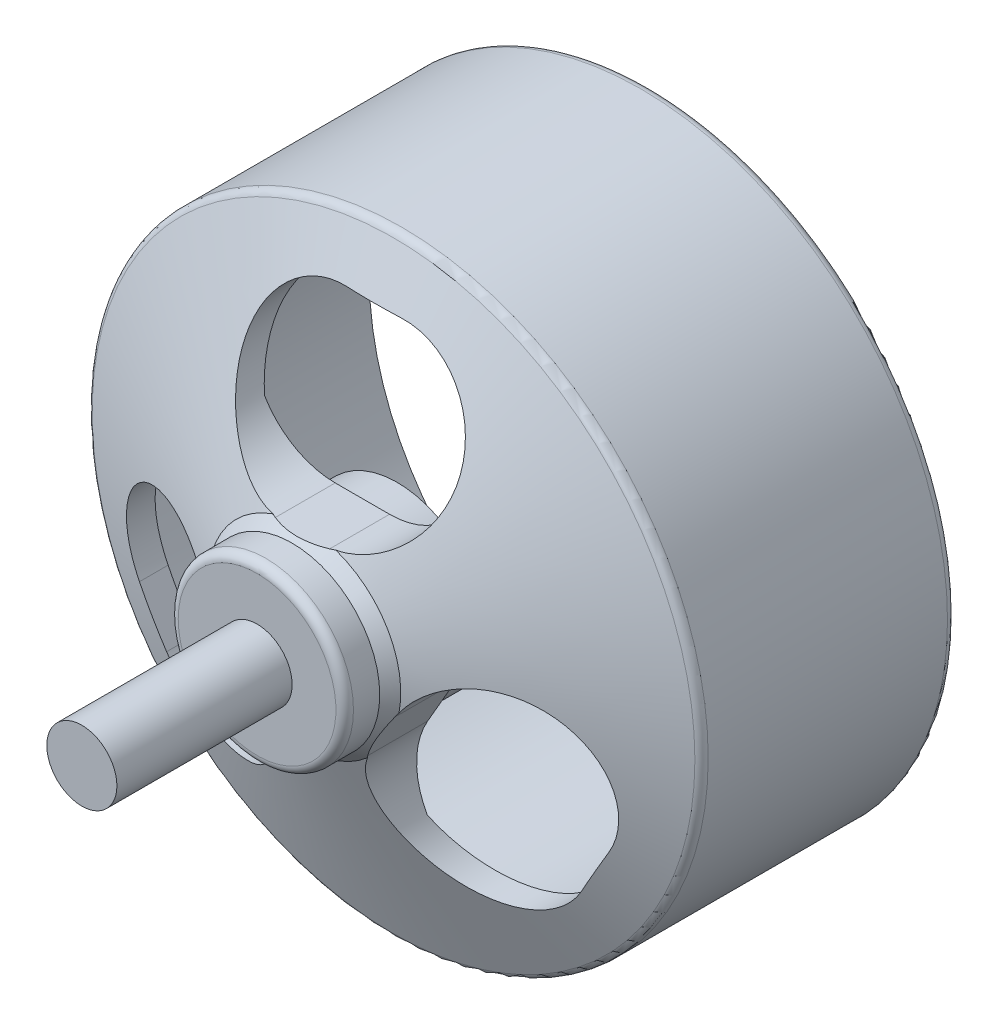
from build123d import *

# Parameters (mm, degrees)
CUT_EXTRUDE_1_DEPTH      = 10
PATTERN_CIRCULAR_1_COUNT = 3
FILLET_1_R               = 0.5


with BuildPart() as part:
    # Эскиз1 → Повернуть1 (revolve)
    with BuildSketch(Plane(origin=(0, 0, 0), x_dir=(0, 0, -1), z_dir=(1, 0, 0))):
        Polygon((-9, 0), (-9, 2), (1, 2), (1, 5), (3, 5), (3.7, 5.5), (8.916460066, 17.5), (23.4, 17.5), (23.4, 16), (9.9, 16), (7.009211714, 9.35), (7.009211714, 5), (9, 5), (9, 0), align=None)
    revolve(axis=Axis((0, 0, -9), (0, 0, -1)))

    # Эскиз2 → Вырез-Вытянуть1 (cut)
    with BuildSketch(Plane.XY.offset(-1)):
        with BuildLine():
            Line((1.55, 14.5641447), (-1.55, 14.5641447))
            ThreePointArc((-1.55, 14.5641447), (-6.235, 9.8791447), (-1.55, 5.1941447))
            Line((-1.55, 5.1941447), (1.55, 5.1941447))
            ThreePointArc((1.55, 5.1941447), (6.235, 9.8791447), (1.55, 14.5641447))
        make_face()
    cut_extrude_1 = extrude(amount=-CUT_EXTRUDE_1_DEPTH, mode=Mode.SUBTRACT)

    # Круговой массив1: Вырез-Вытянуть1 ×3 about axis
    pattern_circular_1_axis = Axis((0, 0, -9), (0, 0, 1))
    for i in range(1, PATTERN_CIRCULAR_1_COUNT):
        add(cut_extrude_1.rotate(pattern_circular_1_axis, i * 360 / PATTERN_CIRCULAR_1_COUNT), mode=Mode.SUBTRACT)

    # Скругление1
    fillet_1_edges = [part.edges().sort_by_distance(p)[0] for p in [
        (0, -17.5, -23.4),
        (0, -17.5, -8.916460066),
        (0, -5, -1),
    ]]
    fillet(fillet_1_edges, radius=FILLET_1_R)


solid = part.part
